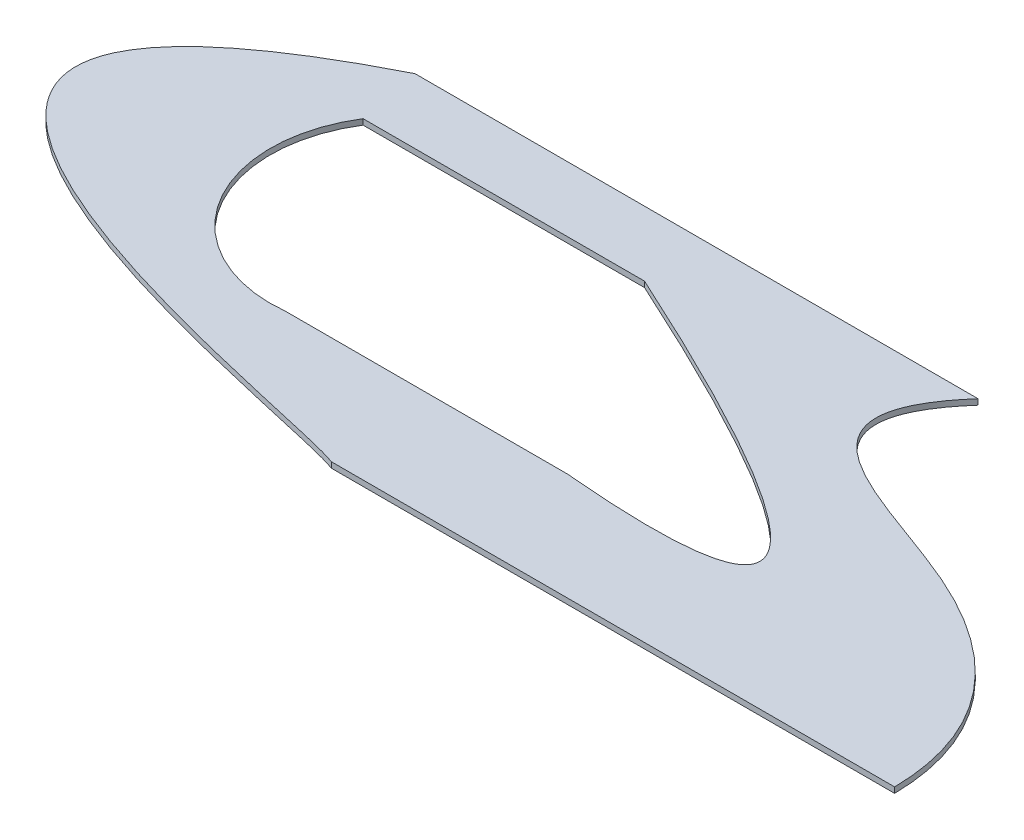
from build123d import *

# Parameters (mm, degrees)
BOSS_EXTRUDE1_DEPTH = 1


with BuildPart() as part:
    # Sketch1 → Boss-Extrude1 (new body)
    with BuildSketch(Plane(origin=(0, 0, 0), x_dir=(1, 0, 0), z_dir=(0, 1, 0))):
        with BuildLine():
            Line((75, 47.608724213), (175, 47.608724213))
            add(Edge.make_bspline(
                [(122.684902166, 114.731222301), (104.771418414, 94.330316096), (153.305840534, 88.724331861), (174.782480386, 64.193226239), (175, 47.608724213)],
                knots=[0, 0, 0, 0, 0.523989749, 1, 1, 1, 1], degree=3))
            Line((122.684902166, 114.731222301), (22.684902166, 114.731222301))
            add(Edge.make_bspline(
                [(22.684902166, 114.731222301), (-65.990695959, 70.226774969), (60.890520772, 52.767344477), (75, 47.608724213)],
                knots=[0, 0, 0, 0, 1, 1, 1, 1], degree=3))
        make_face()
        with BuildLine():
            Line((47.77738764, 66.679890315), (97.77738764, 66.679890315))
            add(Edge.make_bspline(
                [(75, 103.196744247), (168.708371404, 60.293752843), (97.77738764, 66.679890315)],
                knots=[0, 0, 0, 1, 1, 1], degree=2))
            Line((75, 103.196744247), (25, 103.196744247))
            ThreePointArc((25, 103.196744247), (24.929780598, 77.790820159), (47.77738764, 66.679890315))
        make_face(mode=Mode.SUBTRACT)
    extrude(amount=BOSS_EXTRUDE1_DEPTH)


solid = part.part
